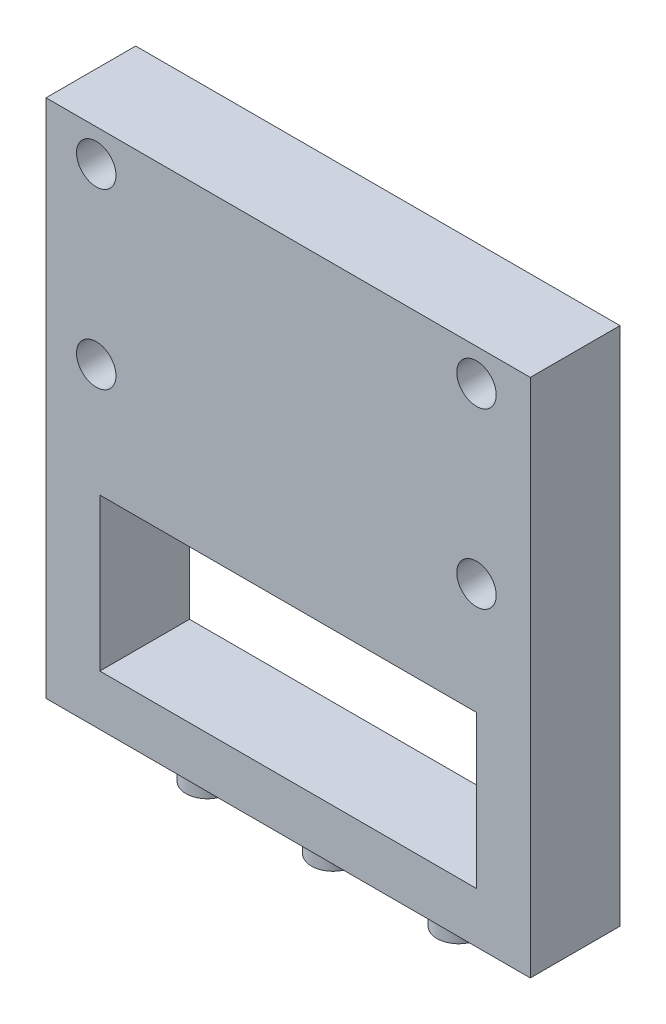
from build123d import *

# Parameters (mm, degrees)
SKETCH1_W           = 27
SKETCH1_H           = 29
BOSS_EXTRUDE1_DEPTH = 5
SKETCH3_R           = 1.1
CUT_EXTRUDE2_DEPTH  = 10
SKETCH4_W           = 21
SKETCH4_H           = 8.5
CUT_EXTRUDE3_DEPTH  = 10
SKETCH2_R           = 1.2
BOSS_EXTRUDE2_DEPTH = 2


with BuildPart() as part:
    # Sketch1 → Boss-Extrude1 (new body)
    with BuildSketch(Plane.XY):
        Rectangle(SKETCH1_W, SKETCH1_H)
    extrude(amount=BOSS_EXTRUDE1_DEPTH)

    # Sketch3 → Cut-Extrude2 (cut)
    with BuildSketch(Plane.XY.offset(5)):
        with Locations((-10.7, 12.7)):
            Circle(SKETCH3_R)
        with Locations((10.5, 12.7)):
            Circle(SKETCH3_R)
        with Locations((-10.7, 3.025)):
            Circle(SKETCH3_R)
        with Locations((10.5, 3.025)):
            Circle(SKETCH3_R)
    extrude(amount=-CUT_EXTRUDE2_DEPTH, mode=Mode.SUBTRACT)

    # Sketch4 → Cut-Extrude3 (cut)
    with BuildSketch(Plane.XY.offset(5)):
        with Locations((0, -7.429078055)):
            Rectangle(SKETCH4_W, SKETCH4_H)
    extrude(amount=-CUT_EXTRUDE3_DEPTH, mode=Mode.SUBTRACT)

    # Sketch2 → Boss-Extrude2 (add)
    with BuildSketch(Plane.XZ.offset(14.5)):
        with Locations((-7, 2.5)):
            Circle(SKETCH2_R)
        with Locations((0, 2.5)):
            Circle(SKETCH2_R)
        with Locations((7, 2.5)):
            Circle(SKETCH2_R)
    extrude(amount=BOSS_EXTRUDE2_DEPTH)


solid = part.part
